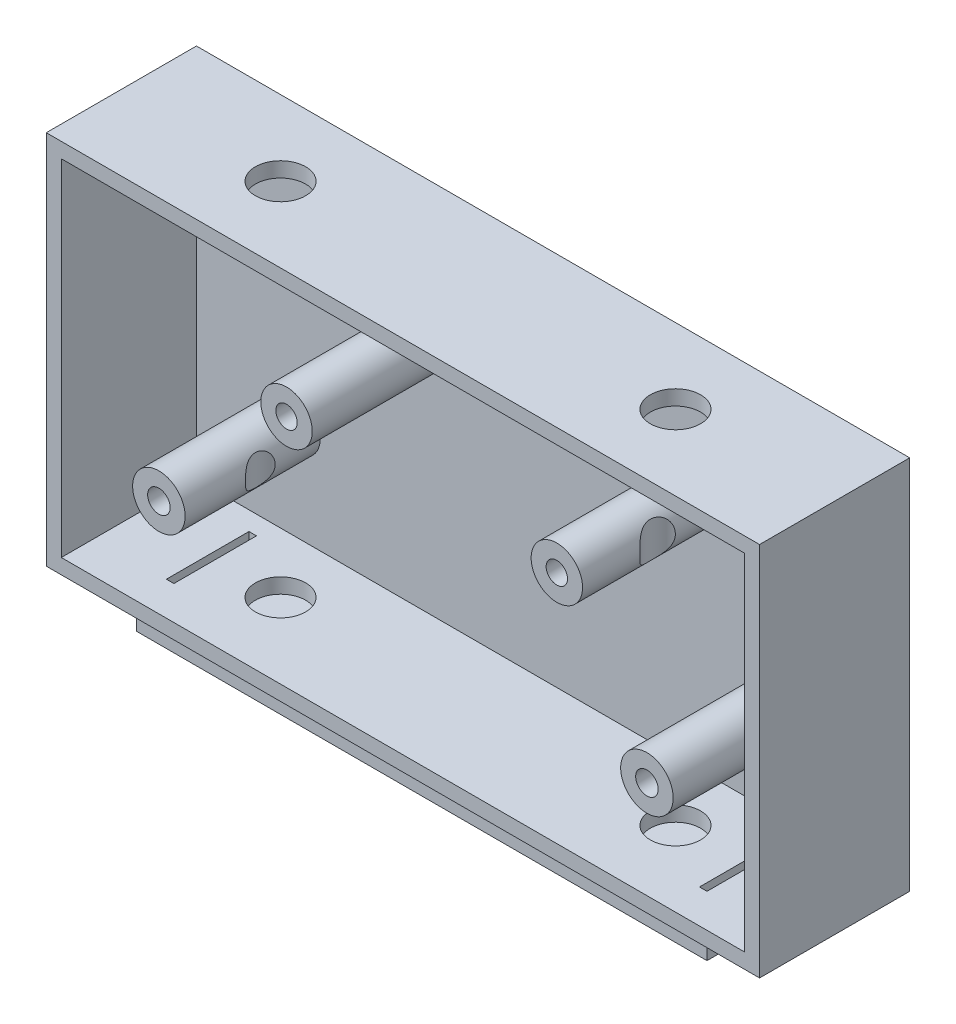
from build123d import *

# Parameters (mm, degrees)
SKETCH1_W               = 95
SKETCH1_H               = 50
BOSS_EXTRUDE1_DEPTH     = 20
SKETCH4_R               = 1.425
CUT_EXTRUDE3_DEPTH      = 58.282196187
LPATTERN1_COUNT         = 2
LPATTERN1_PITCH         = 36
SKETCH5_R               = 1.5
CUT_EXTRUDE4_DEPTH      = 58.282196187
SKETCH6_W               = 5
SKETCH6_H               = 15
BOSS_EXTRUDE2_DEPTH     = 2
SKETCH7_W               = 76
SKETCH7_H               = 15
BOSS_EXTRUDE3_DEPTH     = 2
SHELL1_START            = 2
SHELL1_OUTLINE_W        = 91
SHELL1_OUTLINE_H        = 46
SHELL1_OUTLINE_R        = 3.5
SHELL1_OUTLINE_R_2      = 3.425
SHELL1_DEPTH            = 18
SHELL1_START_2          = 4.5
SHELL1_2_OUTLINE_W      = 1
SHELL1_2_OUTLINE_H      = 4
SHELL1_2_DEPTH          = 11
SKETCH2_R               = 3.35
CUT_EXTRUDE1_DEPTH      = 72.807033082
CUT_EXTRUDE5_DEPTH      = 75.647505009
CUT_EXTRUDE5_DEPTH_BACK = 75.647505009
SKETCH10_R              = 1.425


# Read off the part's stored shape, not the designer's step: Shell1
with BuildPart() as part:
    # Sketch1 → Boss-Extrude1 (new body)
    with BuildSketch(Plane.XY):
        Rectangle(SKETCH1_W, SKETCH1_H)
    extrude(amount=BOSS_EXTRUDE1_DEPTH)

    # Sketch4 → Cut-Extrude3 (cut, through all)
    with BuildSketch(Plane(origin=(0, 0, 0), x_dir=(-1, 0, 0), z_dir=(0, 0, -1))):
        with Locations((15.5, 8.25)):
            Circle(SKETCH4_R)
    cut_extrude3 = extrude(amount=-CUT_EXTRUDE3_DEPTH, mode=Mode.SUBTRACT)

    # LPattern1: Cut-Extrude3 ×2
    with Locations(*[(i * LPATTERN1_PITCH, 0, 0) for i in range(1, LPATTERN1_COUNT)]):
        add(cut_extrude3, mode=Mode.SUBTRACT)

    # Sketch5 → Cut-Extrude4 (cut, through all)
    with BuildSketch(Plane(origin=(0, 0, 0), x_dir=(-1, 0, 0), z_dir=(0, 0, -1))):
        with Locations((-32.5, -10)):
            Circle(SKETCH5_R)
        with Locations((32.5, -10)):
            Circle(SKETCH5_R)
    extrude(amount=-CUT_EXTRUDE4_DEPTH, mode=Mode.SUBTRACT)

    # Sketch6 → Boss-Extrude2 (add)
    with BuildSketch(Plane.XZ.offset(25)):
        with Locations((35.5, 10)):
            Rectangle(SKETCH6_W, SKETCH6_H)
    boss_extrude2 = extrude(amount=BOSS_EXTRUDE2_DEPTH)

    # Mirror1: Boss-Extrude2 across plane
    add(boss_extrude2.mirror(Plane(origin=(0, 0, 0), x_dir=(0, 0, 1), z_dir=(1, 0, 0))))

    # Sketch7 → Boss-Extrude3 (add)
    with BuildSketch(Plane.XZ.offset(27)):
        with Locations((0, 10)):
            Rectangle(SKETCH7_W, SKETCH7_H)
    extrude(amount=BOSS_EXTRUDE3_DEPTH)

    # Shell1 outline → Shell1 (cut)
    with BuildSketch(Plane.XY.offset(SHELL1_START)):
        Rectangle(SHELL1_OUTLINE_W, SHELL1_OUTLINE_H)
        with Locations((-32.5, -10)):
            Circle(SHELL1_OUTLINE_R, mode=Mode.SUBTRACT)
        with Locations((32.5, -10)):
            Circle(SHELL1_OUTLINE_R, mode=Mode.SUBTRACT)
        with Locations((-15.5, 8.25)):
            Circle(SHELL1_OUTLINE_R_2, mode=Mode.SUBTRACT)
        with Locations((20.5, 8.25)):
            Circle(SHELL1_OUTLINE_R_2, mode=Mode.SUBTRACT)
    extrude(amount=SHELL1_DEPTH, mode=Mode.SUBTRACT)

    # Shell1 2 outline → Shell1 2 (cut)
    with BuildSketch(Plane.XY.offset(SHELL1_START_2)):
        with Locations((-35.5, -25)):
            Rectangle(SHELL1_2_OUTLINE_W, SHELL1_2_OUTLINE_H)
        with Locations((35.5, -25)):
            Rectangle(SHELL1_2_OUTLINE_W, SHELL1_2_OUTLINE_H)
    extrude(amount=SHELL1_2_DEPTH, mode=Mode.SUBTRACT)

    # Sketch2 → Cut-Extrude1 (cut, through all)
    with BuildSketch(Plane.XZ.offset(25)):
        with Locations((-26.3, 10)):
            Circle(SKETCH2_R)
        with Locations((26.3, 10)):
            Circle(SKETCH2_R)
    extrude(amount=-CUT_EXTRUDE1_DEPTH, mode=Mode.SUBTRACT)

    # Sketch10 → Cut-Extrude5 (cut, two sides: drawn at the far end of the back side and taken through both)
    with BuildSketch(Plane.XZ.offset(29).offset(-CUT_EXTRUDE5_DEPTH_BACK)):
        with Locations((26.3, 10)):
            Circle(SKETCH10_R)
        with Locations((-26.3, 10)):
            Circle(SKETCH10_R)
    extrude(amount=CUT_EXTRUDE5_DEPTH + CUT_EXTRUDE5_DEPTH_BACK, mode=Mode.SUBTRACT)


solid = part.part
